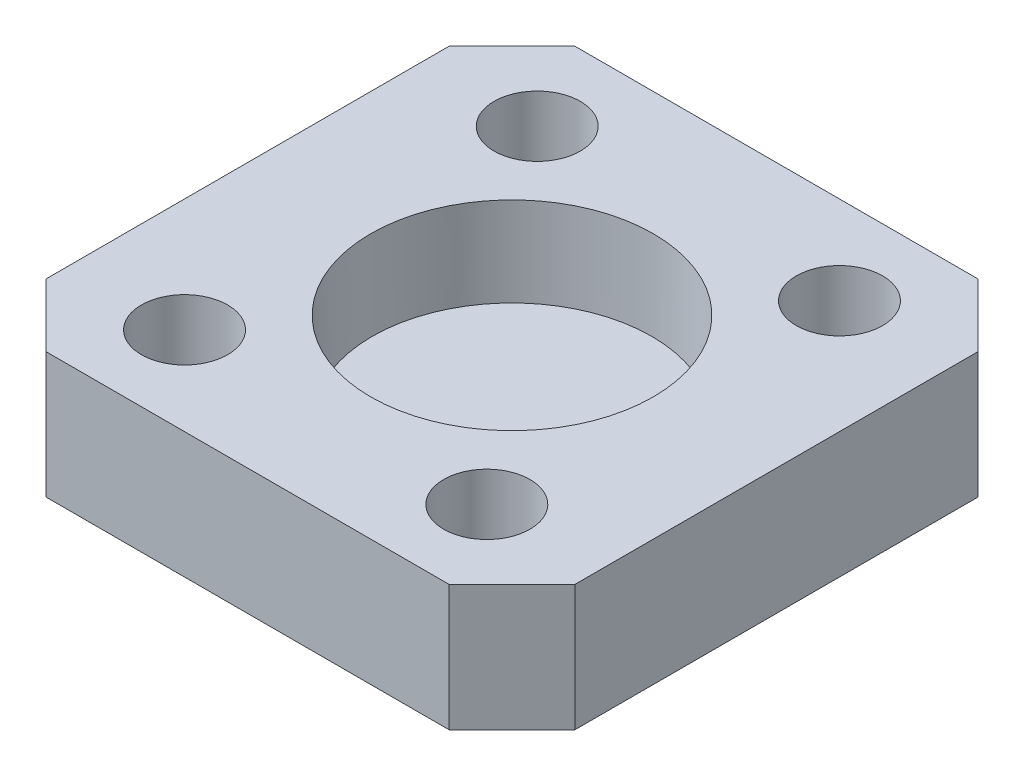
from build123d import *

# Parameters (mm, degrees)
SKETCH1_W           = 42
SKETCH1_H           = 42
BOSS_EXTRUDE1_DEPTH = 10
SKETCH2_R           = 11.1
CUT_EXTRUDE1_DEPTH  = 7
CHAMFER1_SIZE       = 0.122185454
CHAMFER1_SIZE_2     = 7
SKETCH3_R           = 3.425
CUT_EXTRUDE2_DEPTH  = 8
CHAMFER2_SIZE       = 5
CUT_EXTRUDE3_REACH  = 32.757
SKETCH4_R           = 1.675


with BuildPart() as part:
    # Sketch1 → Boss-Extrude1 (new body)
    with BuildSketch(Plane(origin=(0, 0, 0), x_dir=(1, 0, 0), z_dir=(0, 1, 0))):
        Rectangle(SKETCH1_W, SKETCH1_H)
    extrude(amount=BOSS_EXTRUDE1_DEPTH)

    # Sketch2 → Cut-Extrude1 (cut)
    with BuildSketch(Plane(origin=(0, 10, 0), x_dir=(1, 0, 0), z_dir=(0, 1, 0))):
        with Locations(Location((0, 0, 0), (0, 0, 270))):
            Circle(SKETCH2_R)
    extrude(amount=-CUT_EXTRUDE1_DEPTH, mode=Mode.SUBTRACT)

    # Chamfer1
    # the kernel refuses this chamfer: 7, 0.122185454 mm, written as the material it takes off along each edge
    with BuildSketch(Plane(origin=(0, 10, 0), x_dir=(0, 0, 1), z_dir=(-1, 0, 0))) as chamfer1_piece_1_section:
        Polygon((11.1 + CHAMFER1_SIZE * 1.00000000407, 0), (11.1, -CHAMFER1_SIZE_2), (11.1, 0), align=None)
    chamfer1_piece_1 = revolve(axis=Axis((0, 10, 0), (0, 1, 0)), mode=Mode.PRIVATE)
    chamfer1_piece_1 = split(chamfer1_piece_1, bisect_by=Plane(origin=(0, 3, -11.117232441), z_dir=(0, 1, 0)), keep=Keep.TOP, mode=Mode.PRIVATE)
    add(chamfer1_piece_1, mode=Mode.SUBTRACT)

    # Sketch3 → Cut-Extrude2 (cut)
    with BuildSketch(Plane(origin=(0, 10, 0), x_dir=(1, 0, 0), z_dir=(0, 1, 0))):
        with Locations(Location((-12, 14, 0), (0, 0, 270))):
            Circle(SKETCH3_R)
        with Locations(Location((-12, -14, 0), (0, 0, 90))):
            Circle(SKETCH3_R)
        with Locations(Location((12, -14, 0), (0, 0, 270))):
            Circle(SKETCH3_R)
        with Locations(Location((12, 14, 0), (0, 0, 90))):
            Circle(SKETCH3_R)
    extrude(amount=-CUT_EXTRUDE2_DEPTH, mode=Mode.SUBTRACT)

    # Chamfer2
    chamfer2_edges = [part.edges().sort_by_distance(p)[0] for p in [
        (21, 5, 21),
        (-21, 5, 21),
        (-21, 5, -21),
        (21, 5, -21),
    ]]
    chamfer(chamfer2_edges, length=CHAMFER2_SIZE)

    # Sketch4 → Cut-Extrude3 (cut, up to next)
    with BuildSketch(Plane(origin=(0, 2, 0), x_dir=(1, 0, 0), z_dir=(0, 1, 0)), mode=Mode.PRIVATE) as cut_extrude3_sk1:
        with Locations(Location((-12, 14, 0), (0, 0, 270))):
            Circle(SKETCH4_R)
    cut_extrude3_tool1 = extrude(cut_extrude3_sk1.sketch, amount=-CUT_EXTRUDE3_REACH, mode=Mode.PRIVATE) & part.part
    # Sketch4 → Cut-Extrude3 (cut, up to next)
    with BuildSketch(Plane(origin=(0, 2, 0), x_dir=(1, 0, 0), z_dir=(0, 1, 0)), mode=Mode.PRIVATE) as cut_extrude3_sk2:
        with Locations(Location((12, 14, 0), (0, 0, 90))):
            Circle(SKETCH4_R)
    cut_extrude3_tool2 = extrude(cut_extrude3_sk2.sketch, amount=-CUT_EXTRUDE3_REACH, mode=Mode.PRIVATE) & part.part
    # Sketch4 → Cut-Extrude3 (cut, up to next)
    with BuildSketch(Plane(origin=(0, 2, 0), x_dir=(1, 0, 0), z_dir=(0, 1, 0)), mode=Mode.PRIVATE) as cut_extrude3_sk3:
        with Locations(Location((12, -14, 0), (0, 0, 270))):
            Circle(SKETCH4_R)
    cut_extrude3_tool3 = extrude(cut_extrude3_sk3.sketch, amount=-CUT_EXTRUDE3_REACH, mode=Mode.PRIVATE) & part.part
    # Sketch4 → Cut-Extrude3 (cut, up to next)
    with BuildSketch(Plane(origin=(0, 2, 0), x_dir=(1, 0, 0), z_dir=(0, 1, 0)), mode=Mode.PRIVATE) as cut_extrude3_sk4:
        with Locations(Location((-12, -14, 0), (0, 0, 90))):
            Circle(SKETCH4_R)
    cut_extrude3_tool4 = extrude(cut_extrude3_sk4.sketch, amount=-CUT_EXTRUDE3_REACH, mode=Mode.PRIVATE) & part.part
    add(cut_extrude3_tool1.solids().sort_by_distance((-12, 2, -14))[0], mode=Mode.SUBTRACT)
    add(cut_extrude3_tool2.solids().sort_by_distance((12, 2, -14))[0], mode=Mode.SUBTRACT)
    add(cut_extrude3_tool3.solids().sort_by_distance((12, 2, 14))[0], mode=Mode.SUBTRACT)
    add(cut_extrude3_tool4.solids().sort_by_distance((-12, 2, 14))[0], mode=Mode.SUBTRACT)


solid = part.part
